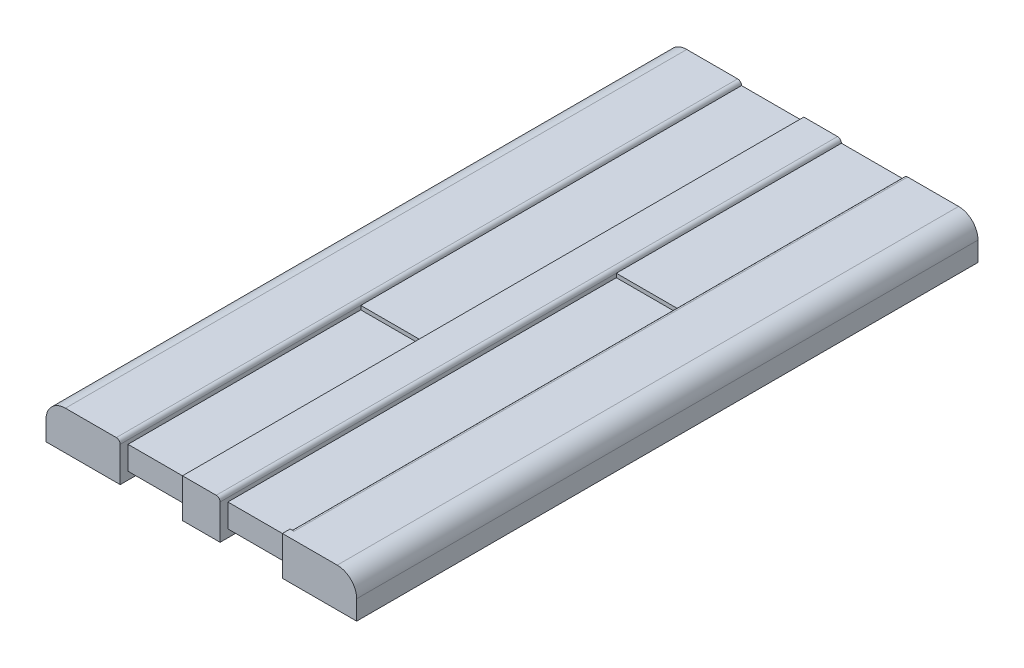
from build123d import *

# Parameters (mm, degrees)
SKETCH2_W           = 40
SKETCH2_H           = 80
BOSS_EXTRUDE1_DEPTH = 5
CUT_EXTRUDE1_DEPTH  = 2.8000000000000003
CUT_EXTRUDE2_DEPTH  = 1
CUT_EXTRUDE3_DEPTH  = 1
CUT_EXTRUDE4_DEPTH  = 0.5
CUT_EXTRUDE5_DEPTH  = 0.5
FILLET1_R           = 0.5
FILLET2_R           = 2.5
F_3DSKETCH6_R       = 1.5500000000000003
F_3DSKETCH6_R_2     = 0.8500000000000008
CUT_EXTRUDE6_DEPTH  = 2.1
FILLET3_START       = -10.446006344
FILLET3_DEPTH       = 8.020486493
FILLET3_START_2     = 2.417038032
FILLET3_2_DEPTH     = 8.020486493


with BuildPart() as part:
    # Sketch2 → Boss-Extrude1 (new body)
    with BuildSketch(Plane(origin=(0, 0, 0), x_dir=(1, 0, 0), z_dir=(0, 1, 0))):
        Rectangle(SKETCH2_W, SKETCH2_H)
    extrude(amount=BOSS_EXTRUDE1_DEPTH)

    # 3DSketch1 → Cut-Extrude1 (cut)
    with BuildSketch(Plane(origin=(-16.51128006150057, 0, -37.5), x_dir=(0.4458957716594368, 0, 0.8950848902848463), z_dir=(0, 1, 0))):
        Polygon((0, 0), (14.72461992821574, 29.557994604621218), (74.05892188684597, 0), (59.334301958630235, -29.557994604621218), align=None)
    extrude(amount=CUT_EXTRUDE1_DEPTH, mode=Mode.SUBTRACT)

    # 3DSketch2 → Cut-Extrude2 (cut)
    with BuildSketch(Plane(origin=(2.4170380320342884, 0, 29.789021971701544), x_dir=(-0.7832232950206466, 0, 0.621740516724623), z_dir=(0, 1, 0))):
        Polygon((0, 0), (-6.28183185870911, 4.986661416535171), (0.06674689686894317, 12.984137273242512), (6.348578755578054, 7.997475856707341), align=None)
        Polygon((3.7928041411073767, -3.0108144401721697), (10.074635999816486, -7.997475856707341), (16.42321475539454, 0), (10.14138289668543, 4.986661416535171), align=None)
    extrude(amount=CUT_EXTRUDE2_DEPTH, mode=Mode.SUBTRACT)

    # 3DSketch3 → Cut-Extrude3 (cut)
    with BuildSketch(Plane(origin=(2.4170380320342884, 1, 40), x_dir=(-0.9548954301559858, 0.29694227968953, 0), z_dir=(0, 0, -1))):
        Polygon((0, 0), (-7.658725899785049, 2.3816215434478725), (-6.470956781026929, 6.2012032640718155), (1.1877691187581199, 3.8195817206239426), align=None)
        Polygon((12.282862292108083, -3.8195817206239426), (4.6241363923230345, -1.43796017717607), (5.811905511081154, 2.381621543447873), (13.470631410866202, 0), align=None)
    extrude(amount=CUT_EXTRUDE3_DEPTH, mode=Mode.SUBTRACT)

    # 3DSketch4 → Cut-Extrude4 (cut)
    with BuildSketch(Plane(origin=(-10.446006343517528, 5, 39), x_dir=(0.25565796932804924, 0, -0.9667672950193641), z_dir=(0, 1, 0))):
        Polygon((0, 0), (76.37461630652976, 20.19697957691589), (78.42511759635093, 12.443035545347499), (2.0505012898211623, -7.753944031568391), align=None)
        Polygon((3.288539804430162, -12.435570616666274), (79.66315611095993, 7.761408960249617), (81.71563147305025, 0), (5.341015166520477, -20.19697957691589), align=None)
    extrude(amount=-CUT_EXTRUDE4_DEPTH, mode=Mode.SUBTRACT)

    # 3DSketch5 → Cut-Extrude5 (cut)
    with BuildSketch(Plane(origin=(10.445246061241729, 4.500000000000001, -11.016513850599985), x_dir=(-0.3854175434043051, 0, 0.9227422810493678), z_dir=(0, 1, 0))):
        Polygon((0, 0), (3.0942122165558494, -7.407966989609723), (49.24656429719578, 11.869274908335926), (46.152352080639936, 19.27724189794565), align=None)
        Polygon((23.45245782033335, -4.152597437612319), (26.543694021369404, -11.553439439280611), (54.20420726112153, 0), (51.11297106008547, 7.400842001668292), align=None)
    extrude(amount=-CUT_EXTRUDE5_DEPTH, mode=Mode.SUBTRACT)

    # Fillet1
    fillet1_edges = [part.edges().sort_by_distance(p)[0] for p in [
        (-10.446006343517528, 5, 7.11e-15),
        (2.4170380320342884, 5, 0),
        (10.445246061241729, 5, -0.5000000000000071),
    ]]
    fillet(fillet1_edges, radius=FILLET1_R)

    # Fillet2
    fillet2_edges = [part.edges().sort_by_distance(p)[0] for p in [
        (-20, 5, 0),
        (20, 5, 0),
    ]]
    fillet(fillet2_edges, radius=FILLET2_R)

    # 3DSketch6 → Cut-Extrude6 (cut)
    with BuildSketch(Plane(origin=(15.004520440934186, 0, 34.437112055137284), x_dir=(-0.41484987007197305, 0, -0.909889875370238), z_dir=(0, -1, 0))):
        with Locations(Location((0, 0, 0), (0, 0, 24.509862444))):
            Circle(F_3DSKETCH6_R)
        with Locations(Location((12.4516160827032, -27.310119209349818, 0), (0, 0, 24.509862444))):
            Circle(F_3DSKETCH6_R)
        with Locations(Location((80.16037328194126, 0, 0), (0, 0, 24.509862444))):
            Circle(F_3DSKETCH6_R_2)
        with Locations(Location((65.01761603264471, 33.2125968942302, 0), (0, 0, 24.509862444))):
            Circle(F_3DSKETCH6_R_2)
    extrude(amount=-CUT_EXTRUDE6_DEPTH, mode=Mode.SUBTRACT)

    # Fillet3: read off the stored shape, not the designer's step
    # Fillet3 outline → Fillet3 (cut)
    with BuildSketch(Plane.YZ.offset(FILLET3_START)):
        with BuildLine():
            Line((0, 28.789021972), (0.580987425, 28.789021972))
            ThreePointArc((0.580987425, 28.789021972), (0.776930768, 29.294705016), (1, 29.789021972))
            Line((1, 29.789021972), (0, 29.789021972))
            Line((0, 29.789021972), (0, 28.789021972))
        make_face()
    extrude(amount=FILLET3_DEPTH, mode=Mode.SUBTRACT)

    # Fillet3 2 outline → Fillet3 2 (cut)
    with BuildSketch(Plane.YZ.offset(FILLET3_START_2)):
        with BuildLine():
            Line((0, 28.789021972), (0.580987425, 28.789021972))
            ThreePointArc((0.580987425, 28.789021972), (0.776930768, 29.294705016), (1, 29.789021972))
            Line((1, 29.789021972), (0, 29.789021972))
            Line((0, 29.789021972), (0, 28.789021972))
        make_face()
    extrude(amount=FILLET3_2_DEPTH, mode=Mode.SUBTRACT)


solid = part.part
